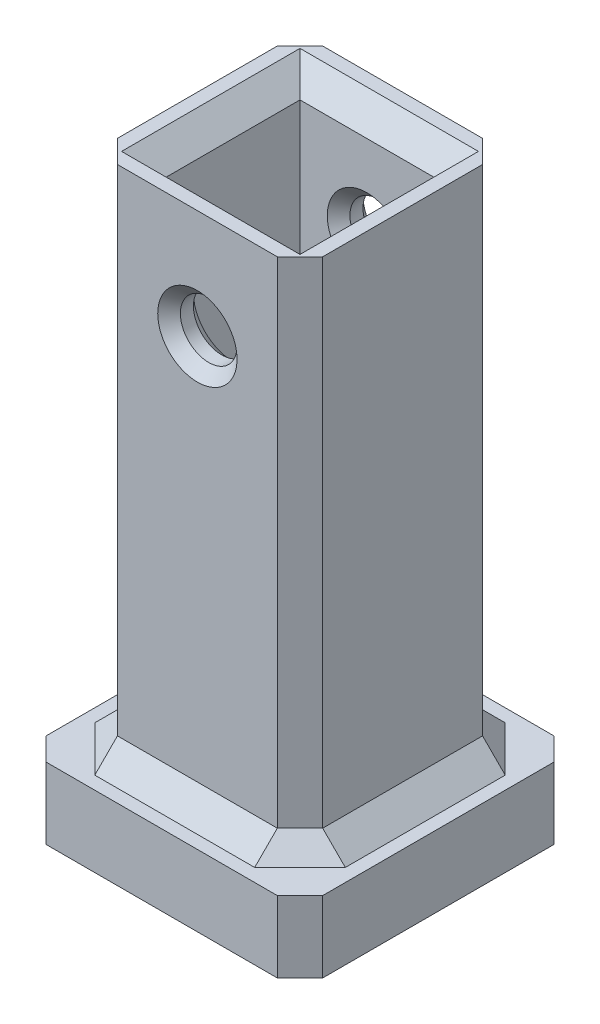
from build123d import *

# Parameters (mm, degrees)
SKETCH1_W           = 23
SKETCH1_H           = 23
SKETCH1_W_2         = 15
SKETCH1_H_2         = 15
BOSS_EXTRUDE1_DEPTH = 66
CHAMFER1_SIZE       = 2.5
SKETCH3_W           = 31
SKETCH3_H           = 31
SKETCH3_W_2         = 23
SKETCH3_H_2         = 23
BOSS_EXTRUDE2_DEPTH = 8
SKETCH4_R           = 3.175
CUT_EXTRUDE1_DEPTH  = 73.974310548
CHAMFER2_SIZE       = 1.27
CHAMFER3_SIZE       = 2.54


with BuildPart() as part:
    # Sketch1 → Boss-Extrude1 (new body)
    with BuildSketch(Plane(origin=(0, 0, 0), x_dir=(1, 0, 0), z_dir=(0, 1, 0))):
        Rectangle(SKETCH1_W, SKETCH1_H)
        Rectangle(SKETCH1_W_2, SKETCH1_H_2, mode=Mode.SUBTRACT)
    extrude(amount=BOSS_EXTRUDE1_DEPTH)

    # Chamfer1
    chamfer1_edges = [part.edges().sort_by_distance(p)[0] for p in [
        (0, 66, -7.5),
        (-7.5, 66, 0),
        (0, 66, 7.5),
        (7.5, 66, 0),
    ]]
    chamfer(chamfer1_edges, length=CHAMFER1_SIZE)

    # Sketch3 → Boss-Extrude2 (add)
    with BuildSketch(Plane.XZ):
        Rectangle(SKETCH3_W, SKETCH3_H)
        Rectangle(SKETCH3_W_2, SKETCH3_H_2, mode=Mode.SUBTRACT)
    extrude(amount=-BOSS_EXTRUDE2_DEPTH)

    # Sketch4 → Cut-Extrude1 (cut, through all)
    with BuildSketch(Plane.XY.offset(11.5)):
        with Locations((0, 53.799893471)):
            Circle(SKETCH4_R)
    extrude(amount=-CUT_EXTRUDE1_DEPTH, mode=Mode.SUBTRACT)

    # Chamfer2
    chamfer2_edges = [part.edges().sort_by_distance(p)[0] for p in [
        (-3.175, 53.799893471, -11.5),
        (-3.175, 53.799893471, -7.5),
        (-3.175, 53.799893471, 7.5),
        (-3.175, 53.799893471, 11.5),
    ]]
    chamfer(chamfer2_edges, length=CHAMFER2_SIZE)

    # Chamfer3
    chamfer3_edges = [part.edges().sort_by_distance(p)[0] for p in [
        (-11.5, 37, -11.5),
        (11.5, 37, -11.5),
        (11.5, 37, 11.5),
        (-11.5, 37, 11.5),
        (-11.5, 8, 0),
        (11.5, 8, 0),
        (-15.5, 4, -15.5),
        (15.5, 4, -15.5),
        (15.5, 4, 15.5),
        (-15.5, 4, 15.5),
        (0, 8, -11.5),
        (0, 8, 11.5),
    ]]
    chamfer(chamfer3_edges, length=CHAMFER3_SIZE)


solid = part.part
